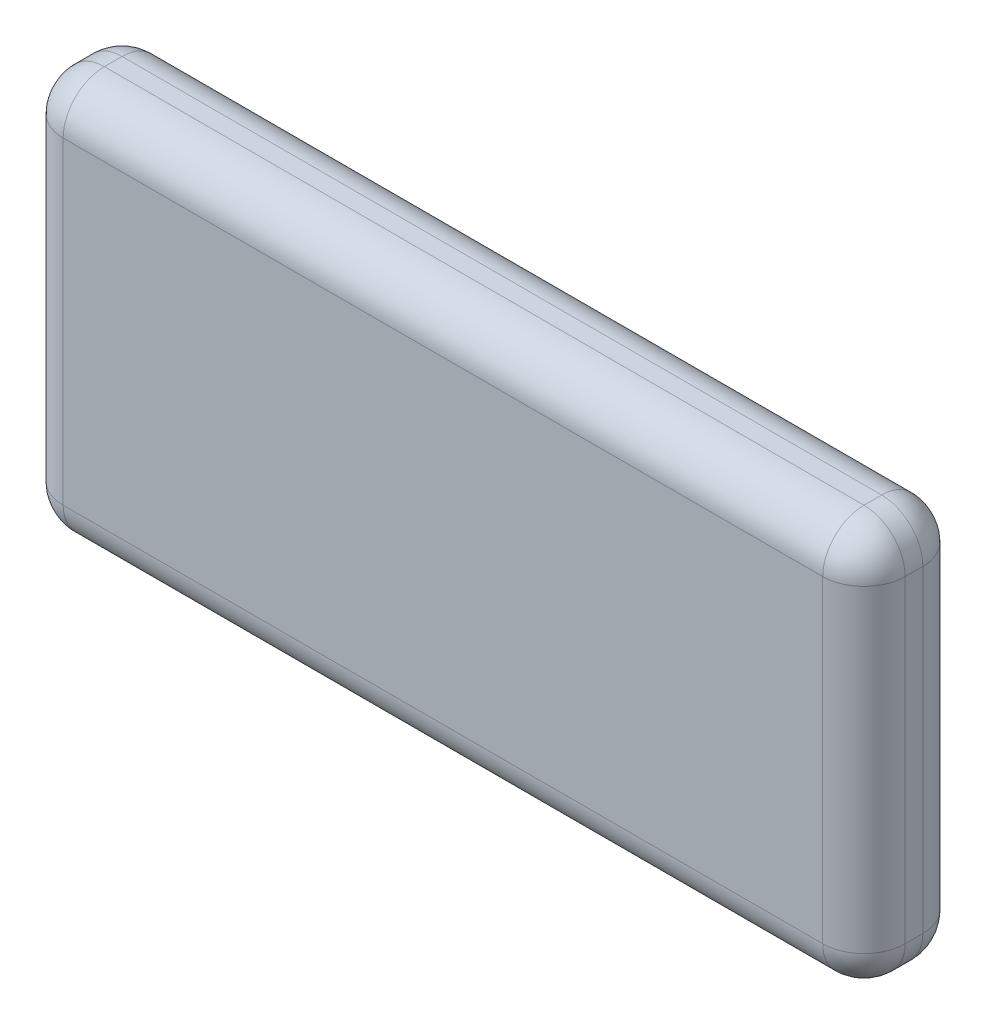
from build123d import *

# Parameters (mm, degrees)
SKETCH1_W           = 143
SKETCH1_H           = 68
BOSS_EXTRUDE1_DEPTH = 17
FILLET1_R           = 7
FILLET2_R           = 7


with BuildPart() as part:
    # Sketch1 → Boss-Extrude1 (new body)
    with BuildSketch(Plane.XY):
        with Locations((-65.703539823, 13.690265487)):
            Rectangle(SKETCH1_W, SKETCH1_H)
    extrude(amount=BOSS_EXTRUDE1_DEPTH)

    # Fillet1
    fillet1_edges = [part.edges().sort_by_distance(p)[0] for p in [
        (5.796460177, 13.690265487, 17),
        (-65.703539823, 47.690265487, 17),
        (-137.203539823, 13.690265487, 17),
        (-65.703539823, 47.690265487, 0),
        (5.796460177, 13.690265487, 0),
        (-65.703539823, -20.309734513, 0),
        (-137.203539823, 13.690265487, 0),
        (-137.203539823, 47.690265487, 8.5),
        (5.796460177, 47.690265487, 8.5),
        (-65.703539823, -20.309734513, 17),
    ]]
    fillet(fillet1_edges, radius=FILLET1_R)

    # Fillet2
    # the kernel refuses this fillet: 7 mm, written as the material it takes off along each edge
    with BuildSketch(Plane(origin=(-130.203539823, -13.309734513, 10), x_dir=(0, -1, 0), z_dir=(-1, 0, 0))) as fillet2_piece_1_section:
        Polygon((0, 0), (FILLET2_R, 0), (FILLET2_R, FILLET2_R), (0, FILLET2_R), align=None)
    fillet2_piece_1 = extrude(amount=FILLET2_R, mode=Mode.PRIVATE)
    fillet2_piece_1 = fillet2_piece_1 - Plane(origin=(-130.203539823, -13.309734513, 10), x_dir=(0, 0.7071067811865475, -0.7071067811865475), z_dir=(-1, 0, 0)) * Sphere(FILLET2_R, mode=Mode.PRIVATE)
    add(fillet2_piece_1, mode=Mode.SUBTRACT)
    with BuildSketch(Plane(origin=(-130.203539823, -13.309734513, 7), x_dir=(0, -1, 0), z_dir=(-1, 0, 0))) as fillet2_piece_2_section:
        Polygon((0, 0), (FILLET2_R, 0), (FILLET2_R, -FILLET2_R), (0, -FILLET2_R), align=None)
    fillet2_piece_2 = extrude(amount=FILLET2_R, mode=Mode.PRIVATE)
    fillet2_piece_2 = fillet2_piece_2 - Plane(origin=(-130.203539823, -13.309734513, 7), x_dir=(0, 0.7071067811865475, 0.7071067811865475), z_dir=(-1, 0, 0)) * Sphere(FILLET2_R, mode=Mode.PRIVATE)
    add(fillet2_piece_2, mode=Mode.SUBTRACT)
    with BuildSketch(Plane(origin=(-1.203539823, -13.309734513, 10), x_dir=(0, -1, 0), z_dir=(1, 0, 0))) as fillet2_piece_3_section:
        Polygon((0, 0), (FILLET2_R, 0), (FILLET2_R, -FILLET2_R), (0, -FILLET2_R), align=None)
    fillet2_piece_3 = extrude(amount=FILLET2_R, mode=Mode.PRIVATE)
    fillet2_piece_3 = fillet2_piece_3 - Plane(origin=(-1.203539823, -13.309734513, 10), x_dir=(0, 0.7071067811865475, -0.7071067811865475), z_dir=(1, 0, 0)) * Sphere(FILLET2_R, mode=Mode.PRIVATE)
    add(fillet2_piece_3, mode=Mode.SUBTRACT)
    with BuildSketch(Plane(origin=(-1.203539823, -13.309734513, 7), x_dir=(0, -1, 0), z_dir=(1, 0, 0))) as fillet2_piece_4_section:
        Polygon((0, 0), (FILLET2_R, 0), (FILLET2_R, FILLET2_R), (0, FILLET2_R), align=None)
    fillet2_piece_4 = extrude(amount=FILLET2_R, mode=Mode.PRIVATE)
    fillet2_piece_4 = fillet2_piece_4 - Plane(origin=(-1.203539823, -13.309734513, 7), x_dir=(0, 0.7071067811865475, 0.7071067811865475), z_dir=(1, 0, 0)) * Sphere(FILLET2_R, mode=Mode.PRIVATE)
    add(fillet2_piece_4, mode=Mode.SUBTRACT)
    with BuildSketch(Plane(origin=(5.796460177, -20.309734513, 7), x_dir=(0, 1, 0), z_dir=(0, 0, 1))) as fillet2_piece_5:
        with BuildLine():
            CenterArc((FILLET2_R, FILLET2_R), FILLET2_R, 180, 90)
            Line((0, FILLET2_R), (0, 0))
            Line((0, 0), (FILLET2_R, 0))
        make_face()
    extrude(amount=3, mode=Mode.SUBTRACT)
    with BuildSketch(Plane(origin=(-137.203539823, -20.309734513, 7), x_dir=(0, 1, 0), z_dir=(0, 0, 1))) as fillet2_piece_6:
        with BuildLine():
            CenterArc((FILLET2_R, -FILLET2_R), FILLET2_R, 90, 90)
            Line((0, -FILLET2_R), (0, 0))
            Line((0, 0), (FILLET2_R, 0))
        make_face()
    extrude(amount=3, mode=Mode.SUBTRACT)


solid = part.part
